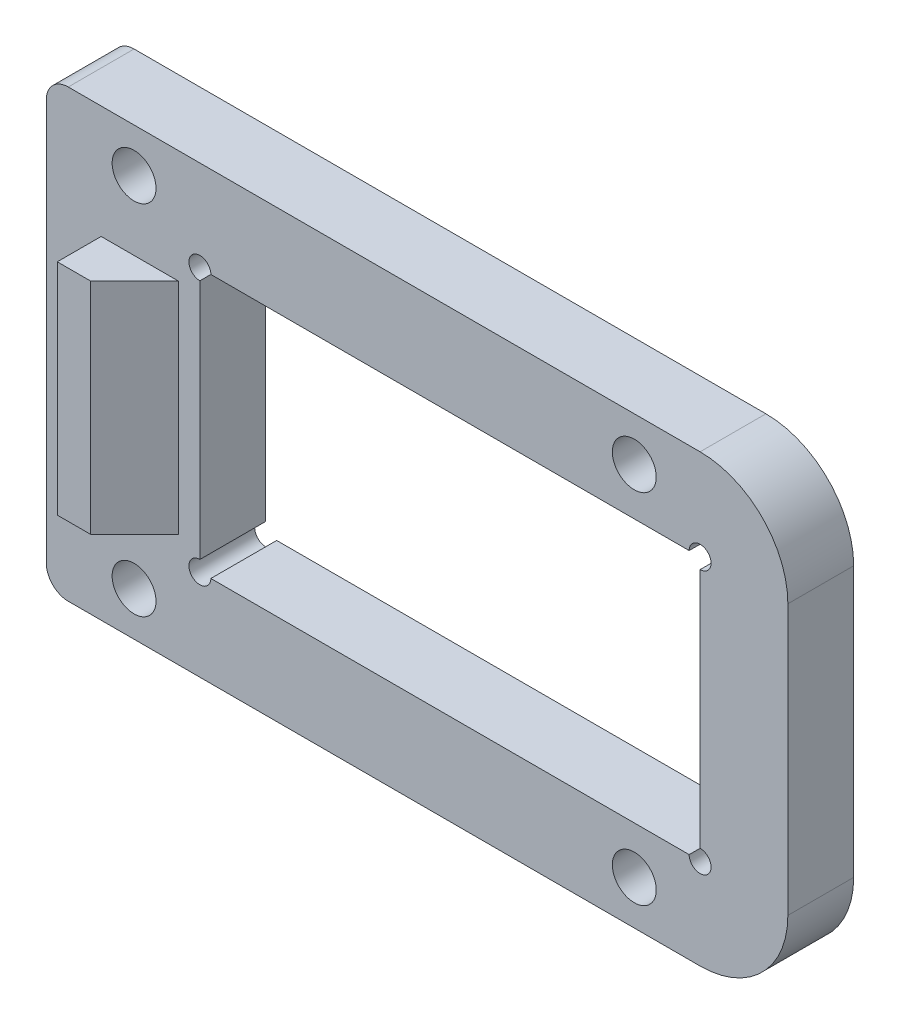
from build123d import *

# Parameters (mm, degrees)
SKETCH2_R           = 1
BOSS_EXTRUDE1_DEPTH = 3
SKETCH3_W           = 3.515258844
SKETCH3_H           = 10
BOSS_EXTRUDE2_DEPTH = 2
CHAMFER1_SIZE       = 2
FILLET1_R           = 4
FILLET2_R           = 1


with BuildPart() as part:
    # Sketch2 → Boss-Extrude1 (new body)
    with BuildSketch(Plane.XY):
        with BuildLine():
            Line((47.48595993, 0.792979965), (51.48595993, 0.792979965))
            Line((51.48595993, 0.792979965), (51.48595993, 10.942979965))
            Line((51.48595993, 10.942979965), (17.68595993, 10.942979965))
            Line((17.68595993, 10.942979965), (17.68595993, 0.792979965))
            Line((17.68595993, 0.792979965), (24.68595993, 0.792979965))
            Line((24.68595993, 0.792979965), (24.68595993, 6.292979965))
            ThreePointArc((24.68595993, 6.292979965), (24.33240654, 7.146533356), (25.18595993, 6.792979965))
            Line((25.18595993, 6.792979965), (46.98595993, 6.792979965))
            ThreePointArc((46.98595993, 6.792979965), (47.839513321, 7.146533356), (47.48595993, 6.292979965))
            Line((47.48595993, 6.292979965), (47.48595993, 0.792979965))
        make_face()
        with Locations((44.48595993, 8.942979965)):
            Circle(SKETCH2_R, mode=Mode.SUBTRACT)
        with Locations((21.68595993, 8.942979965)):
            Circle(SKETCH2_R, mode=Mode.SUBTRACT)
    extrude(amount=BOSS_EXTRUDE1_DEPTH)

    # Mirror1: part across plane


with BuildPart() as part_1:
    add(part.part)
    add(part.part.mirror(Plane(origin=(0, 0.792979965, 3), x_dir=(0, 0, 1), z_dir=(0, -1, 0))))

    # Sketch3 → Boss-Extrude2 (add)
    with BuildSketch(Plane.XY.offset(3)):
        with Locations((21.943589352, 0.792979965)):
            Rectangle(SKETCH3_W, SKETCH3_H)
    extrude(amount=BOSS_EXTRUDE2_DEPTH)

    # Chamfer1
    chamfer1_edges = [part_1.edges().sort_by_distance(p)[0] for p in [
        (23.701218774, 0.792979965, 5),
    ]]
    chamfer(chamfer1_edges, length=CHAMFER1_SIZE - 0.0001)  # a hair under: the kernel refuses the full size

    # Fillet1
    fillet1_edges = [part_1.edges().sort_by_distance(p)[0] for p in [
        (51.48595993, 10.942979965, 1.5),
        (51.48595993, -9.357020035, 1.5),
    ]]
    fillet(fillet1_edges, radius=FILLET1_R)

    # Fillet2
    fillet2_edges = [part_1.edges().sort_by_distance(p)[0] for p in [
        (17.68595993, 10.942979965, 1.5),
        (17.68595993, -9.357020035, 1.5),
    ]]
    fillet(fillet2_edges, radius=FILLET2_R)


solid = part_1.part
